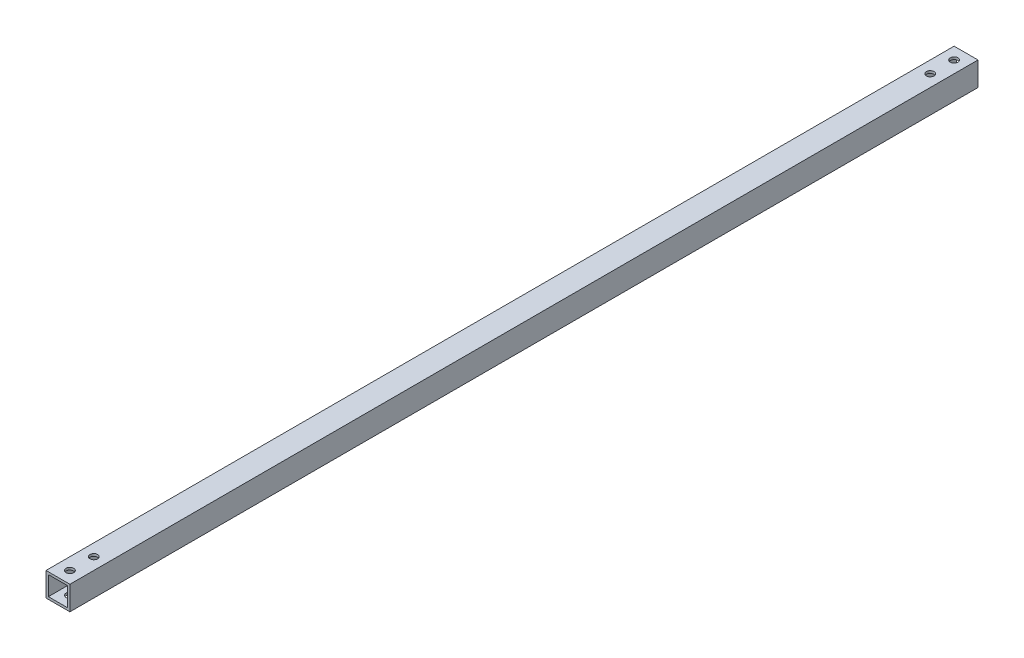
from build123d import *

# Parameters (mm, degrees)
SKETCH_1_W          = 10
SKETCH_1_H          = 10
SKETCH_1_W_2        = 8
SKETCH_1_H_2        = 8
EXTRUDE_1_DEPTH     = 380
SKETCH_2_R          = 1.6
CUT_EXTRUDE_1_DEPTH = 381.164438105


with BuildPart() as part:
    # ｽｹｯﾁ1 → 押し出し-薄板1 (new body)
    with BuildSketch(Plane.XY):
        Rectangle(SKETCH_1_W, SKETCH_1_H)
        Rectangle(SKETCH_1_W_2, SKETCH_1_H_2, mode=Mode.SUBTRACT)
    extrude(amount=EXTRUDE_1_DEPTH)

    # ｽｹｯﾁ2 → ｶｯﾄ - 押し出し1 (cut, through all)
    with BuildSketch(Plane(origin=(0, 5, 0), x_dir=(1, 0, 0), z_dir=(0, 1, 0))):
        with Locations((0, -5)):
            Circle(SKETCH_2_R)
        with Locations((0, -375)):
            Circle(SKETCH_2_R)
        with Locations((0, -15)):
            Circle(SKETCH_2_R)
        with Locations((0, -365)):
            Circle(SKETCH_2_R)
    extrude(amount=-CUT_EXTRUDE_1_DEPTH, mode=Mode.SUBTRACT)


solid = part.part
